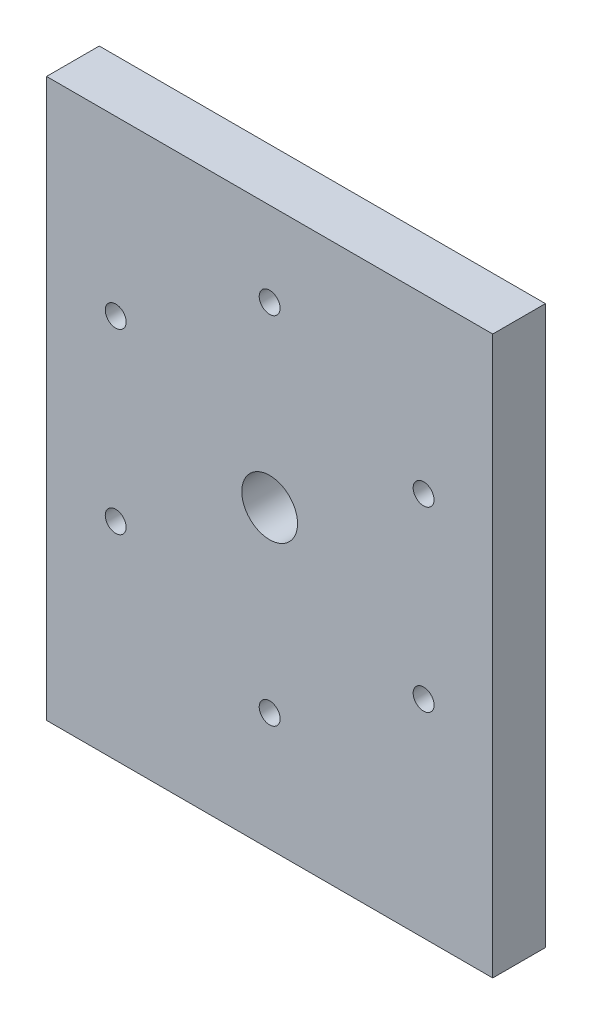
from build123d import *

# Parameters (mm, degrees)
SKETCH1_W           = 101.6
SKETCH1_H           = 127
SKETCH1_R           = 6.35
BOSS_EXTRUDE1_DEPTH = 12.0000014
SKETCH2_R           = 2.38125
CUT_EXTRUDE1_DEPTH  = 138.308557758
CIRPATTERN1_COUNT   = 6


with BuildPart() as part:
    # Sketch1 → Boss-Extrude1 (new body)
    with BuildSketch(Plane.XY):
        with Locations((0, 63.5)):
            Rectangle(SKETCH1_W, SKETCH1_H)
        with Locations((0, 67.3749986)):
            Circle(SKETCH1_R, mode=Mode.SUBTRACT)
    extrude(amount=BOSS_EXTRUDE1_DEPTH)

    # Sketch2 → Cut-Extrude1 (cut, through all)
    with BuildSketch(Plane(origin=(0, 0, 0), x_dir=(-1, 0, 0), z_dir=(0, 0, -1))):
        with Locations((0, 107.8562486)):
            Circle(SKETCH2_R)
    cut_extrude1 = extrude(amount=-CUT_EXTRUDE1_DEPTH, mode=Mode.SUBTRACT)

    # CirPattern1: Cut-Extrude1 ×6 about axis
    cirpattern1_axis = Axis((0, 67.3749986, 12.0000014), (0, 0, -1))
    for i in range(1, CIRPATTERN1_COUNT):
        add(cut_extrude1.rotate(cirpattern1_axis, i * 360 / CIRPATTERN1_COUNT), mode=Mode.SUBTRACT)


solid = part.part
